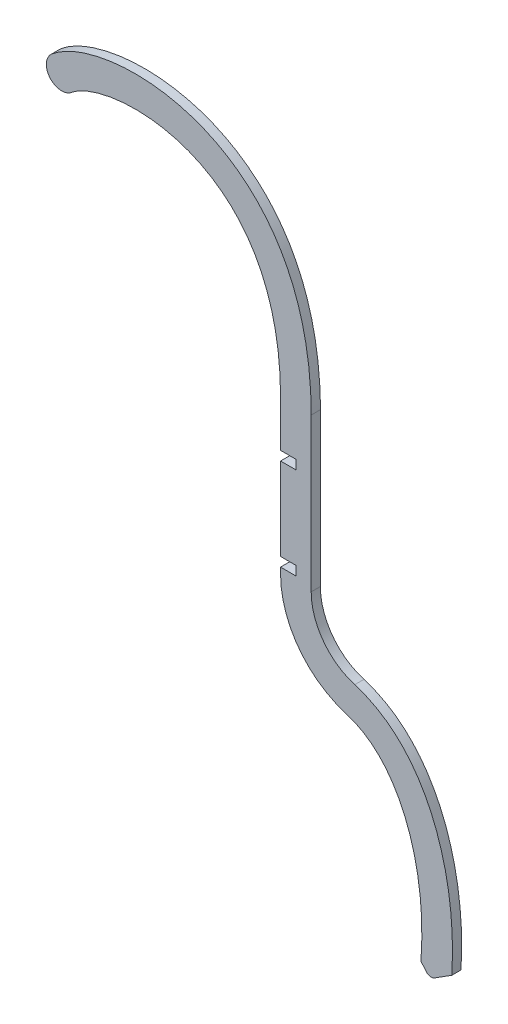
from build123d import *

# Parameters (mm, degrees)
BOSS_EXTRU_2_DEPTH      = 3
ENL_V_MAT_EXTRU_1_DEPTH = 141.768934672
EMPREINTE1_START        = 63.105178129
EMPREINTE1_DEPTH        = 3
EMPREINTE1_START_2      = 93.105178129
EMPREINTE1_2_DEPTH      = 3
BOSS_EXTRU_3_DEPTH      = 3


# Read off the part's stored shape, not the designer's step: Empreinte1
with BuildPart() as part:
    # Esquisse1 → Boss.-Extru.2 (new body)
    with BuildSketch(Plane.XY):
        with BuildLine():
            Line((40.247233076, 111.105178129), (40.247233076, 61.105178129))
            ThreePointArc((40.247233076, 61.105178129), (44.191308202, 49.180108885), (54.467960723, 41.95837654))
            add(Edge.make_bspline(
                [(54.467960723, 41.95837654), (93.469157599, 30.186251687), (94.060386504, -42.130931626), (70.625681641, -69.023414216)],
                knots=[0.073601613, 0.073601613, 0.073601613, 0.073601613, 1, 1, 1, 1], degree=3))
            Line((70.625681641, -69.023414216), (63.086562616, -62.453658944))
            add(Edge.make_bspline(
                [(51.578324546, 32.384975746), (52.441823747, 32.124337068), (54.160244695, 31.504173294), (57.306848095, 29.97035453), (60.909260152, 27.464002891), (64.778911343, 23.487842732), (69.333722485, 16.888912111), (73.713189985, 6.383804922), (76.439302823, -8.617528818), (76.523407917, -21.892716717), (75.336804817, -32.248132674), (73.851279993, -39.698340102), (71.811754469, -46.646923176), (69.699842941, -51.863805262), (67.806756273, -55.601272185), (66.298875889, -58.166006571), (64.985680603, -60.08494816), (63.904092742, -61.488799964), (63.366023798, -62.13296342), (63.086562616, -62.453658944)],
                knots=[0.073601613, 0.073601613, 0.073601613, 0.073601613, 0.102551563, 0.131501512, 0.189401411, 0.247301311, 0.30520121, 0.421001008, 0.536800806, 0.652600605, 0.710500504, 0.768400403, 0.826300302, 0.884200202, 0.913150151, 0.942100101, 0.97105005, 0.985525025, 1, 1, 1, 1], degree=3))
            ThreePointArc((51.578324546, 32.384975746), (36.163345766, 43.217574263), (30.247233076, 61.105178129))
            Line((30.247233076, 61.105178129), (30.247233076, 111.105178129))
            Line((30.247233076, 111.105178129), (40.247233076, 111.105178129))
        make_face()
    extrude(amount=BOSS_EXTRU_2_DEPTH)

    # Esquisse2 → Enlèv. mat.-Extru.1 (cut, through all)
    with BuildSketch(Plane.XY.offset(3)):
        with BuildLine():
            Line((58.604840791, -65.718091867), (72.675095618, -21.396789164))
            Line((72.675095618, -21.396789164), (77.883188433, -27.569343611))
            ThreePointArc((77.883188433, -27.569343611), (79.106345528, -28.256142913), (80.479757382, -27.970579539))
            Line((80.479757382, -27.970579539), (87.91787168, -23.272823141))
            Line((87.91787168, -23.272823141), (76.157367596, -75.355055511))
            Line((76.157367596, -75.355055511), (58.604840791, -65.718091867))
        make_face()
    extrude(amount=-ENL_V_MAT_EXTRU_1_DEPTH, mode=Mode.SUBTRACT)

    # Empreinte1 outline → Empreinte1 (cut)
    with BuildSketch(Plane(origin=(0, 0, 0), x_dir=(1, 0, 0), z_dir=(0, 1, 0)).offset(EMPREINTE1_START)):
        with BuildLine():
            ThreePointArc((40.222725568, -0.2), (40.219098005, -0.099995306), (40.215220265, 0))
            Line((40.215220265, 0), (30.247233076, 0))
            Line((30.247233076, 0), (30.247233076, -3))
            Line((30.247233076, -3), (35.247233076, -3))
            Line((35.247233076, -3), (35.247233076, -0.2))
            Line((35.247233076, -0.2), (40.222725568, -0.2))
        make_face()
    extrude(amount=EMPREINTE1_DEPTH, mode=Mode.SUBTRACT)

    # Empreinte1 2 outline → Empreinte1 2 (cut)
    with BuildSketch(Plane(origin=(0, 0, 0), x_dir=(1, 0, 0), z_dir=(0, 1, 0)).offset(EMPREINTE1_START_2)):
        with BuildLine():
            ThreePointArc((40.222725568, -0.2), (40.219098005, -0.099995306), (40.215220265, 0))
            Line((40.215220265, 0), (30.247233076, 0))
            Line((30.247233076, 0), (30.247233076, -3))
            Line((30.247233076, -3), (35.247233076, -3))
            Line((35.247233076, -3), (35.247233076, -0.2))
            Line((35.247233076, -0.2), (40.222725568, -0.2))
        make_face()
    extrude(amount=EMPREINTE1_2_DEPTH, mode=Mode.SUBTRACT)

    # Esquisse3 → Boss.-Extru.3 (add)
    with BuildSketch(Plane(origin=(0, 0, 0), x_dir=(-1, 0, 0), z_dir=(0, 0, -1))):
        with BuildLine():
            Line((-40.247233076, 111.105178129), (-30.247233076, 111.105178129))
            add(Edge.make_bspline(
                [(-30.247233076, 111.105178129), (-30.247233076, 112.14596965), (-30.217698493, 114.25472522), (-30.045014328, 118.252405482), (-29.624674548, 122.993020115), (-28.820656407, 128.236554261), (-27.74447291, 133.062686625), (-26.422917169, 137.485210513), (-24.367231012, 142.870966444), (-21.306772788, 148.697507946), (-17.00171943, 154.423085647), (-12.168743747, 159.053182078), (-6.886412749, 162.716784457), (0.639998699, 166.423733084), (8.67921262, 168.46569452), (16.603362122, 169.022509829), (22.293283685, 168.760231201), (27.526974489, 167.899846277), (31.325094184, 166.77680064), (33.908111954, 165.718326704), (35.589474071, 164.872941274), (36.748498996, 164.160369864), (37.530944286, 163.599193527), (37.852299425, 163.343502605), (38.016109762, 163.205698113)],
                knots=[0, 0, 0, 0, 0.015625, 0.03125, 0.0625, 0.09375, 0.125, 0.15625, 0.1875, 0.25, 0.3125, 0.375, 0.4375, 0.5, 0.625, 0.6875, 0.75, 0.8125, 0.875, 0.90625, 0.9375, 0.96875, 0.984375, 1, 1, 1, 1], degree=3))
            ThreePointArc((38.016109762, 163.205698113), (45.061039216, 163.813126294), (44.453611035, 170.858055748))
            add(Edge.make_bspline(
                [(-40.247233076, 111.105178129), (-40.247233076, 184.874305638), (25.539277275, 186.769628817), (44.453611035, 170.858055748)],
                knots=[0, 0, 0, 0, 1, 1, 1, 1], degree=3))
        make_face()
    extrude(amount=-BOSS_EXTRU_3_DEPTH)


solid = part.part
